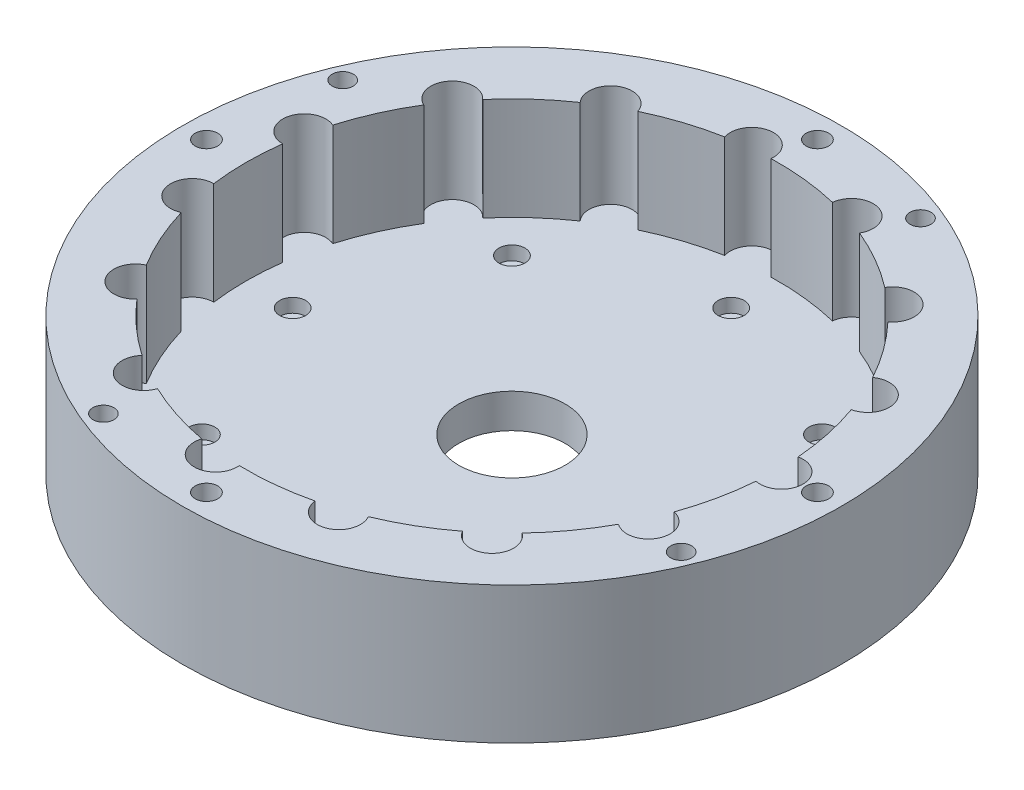
from build123d import *

# Parameters (mm, degrees)
SKETCH1_R           = 45.85
SKETCH1_R_2         = 1.5635
SKETCH1_R_3         = 7.4
BOSS_EXTRUDE1_DEPTH = 4.7625
SKETCH1_6_R         = 1.8125
CUT_EXTRUDE1_DEPTH  = 1.9125
BOSS_EXTRUDE2_START = 14.2875
SKETCH1_7_R         = 45.85
SKETCH1_7_R_2       = 1.5635
BOSS_EXTRUDE2_DEPTH = 14.2875
SKETCH3_R           = 1.46
DOWEL_HOLES_DEPTH   = 68.582153709


with BuildPart() as part:
    # Sketch1 → Boss-Extrude1 (new body)
    with BuildSketch(Plane(origin=(0, 0, 0), x_dir=(1, 0, 0), z_dir=(0, 1, 0))):
        Circle(SKETCH1_R)
        with Locations((0, -42.5)):
            Circle(SKETCH1_R_2, mode=Mode.SUBTRACT)
        with Locations((-42.5, 0)):
            Circle(SKETCH1_R_2, mode=Mode.SUBTRACT)
        with Locations((42.5, 0)):
            Circle(SKETCH1_R_2, mode=Mode.SUBTRACT)
        with Locations((0, 42.5)):
            Circle(SKETCH1_R_2, mode=Mode.SUBTRACT)
        Circle(SKETCH1_R_3, mode=Mode.SUBTRACT)
    extrude(amount=-BOSS_EXTRUDE1_DEPTH)

    # Sketch1<6> → Cut-Extrude1 (cut)
    with BuildSketch(Plane(origin=(0, 0, 0), x_dir=(1, 0, 0), z_dir=(0, 1, 0))):
        with Locations((30.5, 0)):
            Circle(SKETCH1_6_R)
        with Locations((21.566756826, -21.566756826)):
            Circle(SKETCH1_6_R)
        with Locations((0, -30.5)):
            Circle(SKETCH1_6_R)
        with Locations((-21.566756826, -21.566756826)):
            Circle(SKETCH1_6_R)
        with Locations((-30.5, 0)):
            Circle(SKETCH1_6_R)
        with Locations((-21.566756826, 21.566756826)):
            Circle(SKETCH1_6_R)
        with Locations((0, 30.5)):
            Circle(SKETCH1_6_R)
        with Locations((21.566756826, 21.566756826)):
            Circle(SKETCH1_6_R)
    extrude(amount=-CUT_EXTRUDE1_DEPTH, mode=Mode.SUBTRACT)

    # Sketch1<7> → Boss-Extrude2 (add)
    with BuildSketch(Plane(origin=(0, 0, 0), x_dir=(1, 0, 0), z_dir=(0, 1, 0)).offset(BOSS_EXTRUDE2_START)):
        Circle(SKETCH1_7_R)
        with Locations((0, -42.5)):
            Circle(SKETCH1_7_R_2, mode=Mode.SUBTRACT)
        with Locations((-42.5, 0)):
            Circle(SKETCH1_7_R_2, mode=Mode.SUBTRACT)
        with Locations((42.5, 0)):
            Circle(SKETCH1_7_R_2, mode=Mode.SUBTRACT)
        with BuildLine():
            ThreePointArc((36.883333333, 2.935936345), (39.39076704, 2.32916294), (40.5, 0))
            ThreePointArc((40.5, 0), (39.39076704, -2.32916294), (36.883333333, -2.935936345))
            ThreePointArc((36.883333333, -2.935936345), (36.191461227, -7.69273256), (34.888754523, -12.319691873))
            ThreePointArc((34.888754523, -12.319691873), (36.59166411, -13.367471546), (37.257954662, -15.252624115))
            ThreePointArc((37.257954662, -15.252624115), (35.6231437, -17.924001829), (32.500448736, -17.683914497))
            ThreePointArc((32.500448736, -17.683914497), (29.933628792, -21.748054335), (26.861593101, -25.445133446))
            ThreePointArc((26.861593101, -25.445133446), (27.767055295, -26.50917897), (28.092397738, -27.867930955))
            ThreePointArc((28.092397738, -27.867930955), (25.872343464, -30.764771418), (22.497941295, -29.37418318))
            ThreePointArc((22.497941295, -29.37418318), (18.5, -32.04293994), (14.189818202, -34.170880284))
            ThreePointArc((14.189818202, -34.170880284), (14.486847583, -34.891651942), (14.588137289, -35.664619361))
            ThreePointArc((14.588137289, -35.664619361), (11.748752331, -38.660316744), (8.605335417, -35.985388734))
            ThreePointArc((8.605335417, -35.985388734), (3.867553141, -36.797310129), (-0.935505175, -36.988171489))
            ThreePointArc((-0.935505175, -36.988171489), (-0.92374189, -37.141170608), (-0.919817373, -37.294571076))
            ThreePointArc((-0.919817373, -37.294571076), (-4.385552663, -40.258199029), (-6.775211132, -36.37439366))
            ThreePointArc((-6.775211132, -36.37439366), (-11.433628792, -35.189091103), (-15.899071208, -33.409871815))
            ThreePointArc((-15.899071208, -33.409871815), (-20.25, -35.074028853), (-20.984262125, -30.47393547))
            ThreePointArc((-20.984262125, -30.47393547), (-24.757832435, -27.496358543), (-28.113543391, -24.054701786))
            ThreePointArc((-28.113543391, -24.054701786), (-32.765188272, -23.805302718), (-31.564943561, -19.304256991))
            ThreePointArc((-31.564943561, -19.304256991), (-33.801181933, -15.049255794), (-35.466928517, -10.540255288))
            ThreePointArc((-35.466928517, -10.540255288), (-39.61497783, -8.420423478), (-36.687759497, -4.796697105))
            ThreePointArc((-36.687759497, -4.796697105), (-37, 0), (-36.687759497, 4.796697105))
            ThreePointArc((-36.687759497, 4.796697105), (-39.61497783, 8.420423478), (-35.466928517, 10.540255288))
            ThreePointArc((-35.466928517, 10.540255288), (-33.801181933, 15.049255794), (-31.564943561, 19.304256991))
            ThreePointArc((-31.564943561, 19.304256991), (-32.765188272, 23.805302718), (-28.113543391, 24.054701786))
            ThreePointArc((-28.113543391, 24.054701786), (-24.757832435, 27.496358543), (-20.984262125, 30.47393547))
            ThreePointArc((-20.984262125, 30.47393547), (-20.25, 35.074028853), (-15.899071208, 33.409871815))
            ThreePointArc((-15.899071208, 33.409871815), (-11.433628792, 35.189091103), (-6.775211132, 36.37439366))
            ThreePointArc((-6.775211132, 36.37439366), (-4.385552663, 40.258199029), (-0.919817373, 37.294571076))
            ThreePointArc((-0.919817373, 37.294571076), (-0.92374189, 37.141170608), (-0.935505175, 36.988171489))
            ThreePointArc((-0.935505175, 36.988171489), (3.867553141, 36.797310129), (8.605335417, 35.985388734))
            ThreePointArc((8.605335417, 35.985388734), (11.748752331, 38.660316744), (14.588137289, 35.664619361))
            ThreePointArc((14.588137289, 35.664619361), (14.486847583, 34.891651942), (14.189818202, 34.170880284))
            ThreePointArc((14.189818202, 34.170880284), (18.5, 32.04293994), (22.497941295, 29.37418318))
            ThreePointArc((22.497941295, 29.37418318), (25.872343464, 30.764771418), (28.092397738, 27.867930955))
            ThreePointArc((28.092397738, 27.867930955), (27.767055295, 26.50917897), (26.861593101, 25.445133446))
            ThreePointArc((26.861593101, 25.445133446), (29.933628792, 21.748054335), (32.500448736, 17.683914497))
            ThreePointArc((32.500448736, 17.683914497), (35.6231437, 17.924001829), (37.257954662, 15.252624115))
            ThreePointArc((37.257954662, 15.252624115), (36.59166411, 13.367471546), (34.888754523, 12.319691873))
            ThreePointArc((34.888754523, 12.319691873), (36.191461227, 7.69273256), (36.883333333, 2.935936345))
        make_face(mode=Mode.SUBTRACT)
        with Locations((0, 42.5)):
            Circle(SKETCH1_7_R_2, mode=Mode.SUBTRACT)
    extrude(amount=-BOSS_EXTRUDE2_DEPTH)

    # Sketch3 → Dowel Holes (cut, through all)
    with BuildSketch(Plane(origin=(0, 14.2875, 0), x_dir=(1, 0, 0), z_dir=(0, 1, 0))):
        with Locations((-40.188759664, 16.646729308)):
            Circle(SKETCH3_R)
        with Locations((16.646729308, 40.188759664)):
            Circle(SKETCH3_R)
        with Locations((40.188759664, -16.646729308)):
            Circle(SKETCH3_R)
        with Locations((-16.646729308, -40.188759664)):
            Circle(SKETCH3_R)
    extrude(amount=-DOWEL_HOLES_DEPTH, mode=Mode.SUBTRACT)


solid = part.part
